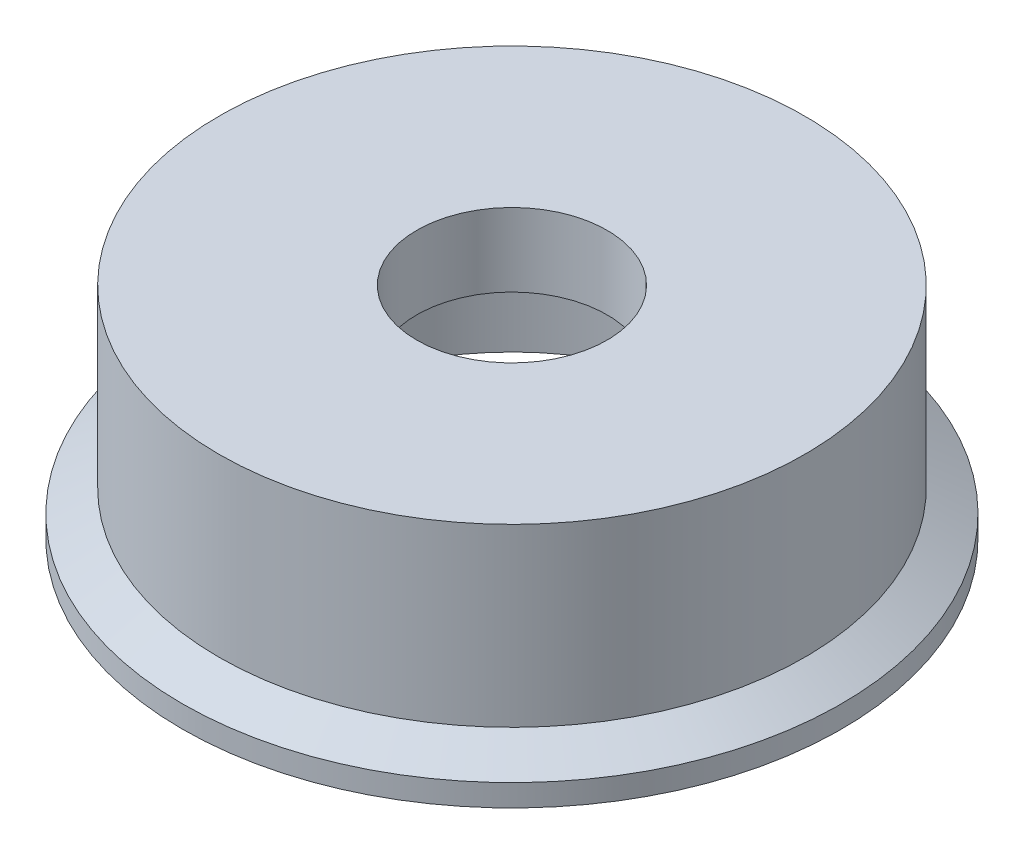
from build123d import *


with BuildPart() as part:
    # Sketch1 → Revolve1 (revolve)
    with BuildSketch(Plane.XY):
        Polygon((-3.302, 7.62), (-10.16, 7.62), (-10.16, 1.524), (-11.43, 0.762), (-11.43, 0), (-7.9375, 0), (-7.9375, 5.08), (-3.302, 5.08), align=None)
    revolve(axis=Axis((0, 7.62, 0), (0, -1, 0)))


solid = part.part
